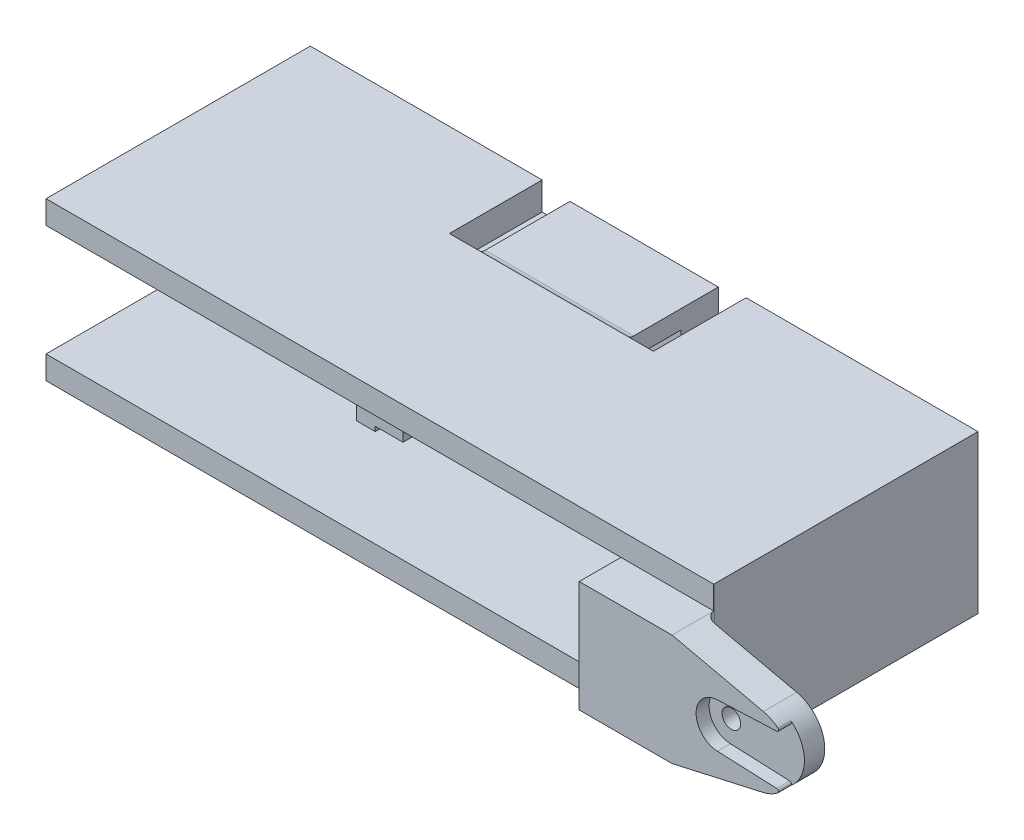
from build123d import *

# Parameters (mm, degrees)
BOSS_EXTRUDE1_DEPTH      = 8.5
BOSS_EXTRUDE1_DEPTH_BACK = 8.5
SKETCH1_W                = 72
SKETCH1_H                = 28.5
SKETCH2_W                = 31.201469113
SKETCH2_H                = 12
CUT_EXTRUDE1_DEPTH       = 69
SKETCH3_W                = 10
SKETCH3_H                = 17
BOSS_EXTRUDE2_DEPTH      = 3
CUT_EXTRUDE2_DEPTH       = 10
FILLET1_R                = 1
BOSS_EXTRUDE3_DEPTH      = 2
SKETCH8_W                = 12.8
SKETCH8_H                = 12.8
SKETCH8_R                = 3.26
SKETCH8_R_2              = 2.4
CUT_EXTRUDE3_DEPTH       = 2
SKETCH11_W               = 26
SKETCH11_H               = 12
BOSS_EXTRUDE7_DEPTH      = 3.1
SKETCH14_R               = 1
CUT_EXTRUDE4_DEPTH       = 62.43948242
CUT_EXTRUDE6_DEPTH       = 62.43948242
CUT_EXTRUDE7_DEPTH       = 62.43948242
BOSS_EXTRUDE8_DEPTH      = 14
SKETCH19_R               = 1
CUT_EXTRUDE8_DEPTH       = 5
SKETCH20_W               = 17.87603411
SKETCH20_H               = 5.867107887
CUT_EXTRUDE9_DEPTH       = 62.686708455
FILLET4_R                = 1
CUT_EXTRUDE10_DEPTH      = 10
BOSS_EXTRUDE9_START      = 1.4
BOSS_EXTRUDE9_DEPTH      = 1.4
FILLET5_R                = 0.2


with BuildPart() as part:
    # Sketch1 → Boss-Extrude1 (new, two sides: drawn at the far end of the back side and taken through both)
    with BuildSketch(Plane(origin=(0, 0, 0), x_dir=(1, 0, 0), z_dir=(0, 1, 0)).offset(-BOSS_EXTRUDE1_DEPTH_BACK)):
        with Locations((0, 14.25)):
            Rectangle(SKETCH1_W, SKETCH1_H)
    extrude(amount=BOSS_EXTRUDE1_DEPTH + BOSS_EXTRUDE1_DEPTH_BACK)

    # Sketch2 → Cut-Extrude1 (cut)
    with BuildSketch(Plane.ZY.offset(36)):
        with Locations((-10.899265443, 0)):
            Rectangle(SKETCH2_W, SKETCH2_H)
    extrude(amount=-CUT_EXTRUDE1_DEPTH, mode=Mode.SUBTRACT)

    # Sketch3 → Boss-Extrude2 (add)
    with BuildSketch(Plane.XY):
        with Locations((31, 0)):
            Rectangle(SKETCH3_W, SKETCH3_H)
    extrude(amount=-BOSS_EXTRUDE2_DEPTH)

    # Sketch6 → Cut-Extrude2 (cut)
    with BuildSketch(Plane(origin=(0, 0, -28.5), x_dir=(-1, 0, 0), z_dir=(0, 0, -1))):
        Polygon((-11, 8.5), (-11, 5.5), (-8, 5.5), (-8, 8), (8, 8), (8, 5.5), (11, 5.5), (11, 8.5), align=None)
        Polygon((-11, -5.5), (-11, -8.5), (11, -8.5), (11, -5.5), (8, -5.5), (8, -8), (-8, -8), (-8, -5.5), align=None)
    extrude(amount=-CUT_EXTRUDE2_DEPTH, mode=Mode.SUBTRACT)

    # Fillet1
    # the kernel refuses this fillet: 1 mm, written as the material it adds along each edge
    with BuildSketch(Plane(origin=(-8, -8, -18.5), x_dir=(0, 0, -1), z_dir=(1, 0, 0)), Plane(origin=(8, 8, -18.5), x_dir=(0, 0, -1), z_dir=(-1, 0, 0))) as fillet1_piece_1:
        with BuildLine():
            CenterArc((0.866025404, -1), FILLET1_R, 90, 60)
            Line((0, -0.5), (-0.017320508, -0.49))
            ThreePointArc((-0.017320508, -0.49), (-0.02, -0.25), (-0.02, 0))
            Line((-0.02, 0), (0, 0.02))
            Line((0, 0.02), (0.866025404, 0.02))
            Line((0.866025404, 0.02), (0.866025404, 0))
        make_face()
    extrude(amount=16)

    # Sketch7 → Boss-Extrude3 (add)
    with BuildSketch(Plane.XY.offset(-26.5)):
        Polygon((33, -6), (33, 6), (11, 6), (11, 5.5), (8, 5.5), (8, 6), (-8, 6), (-8, 5.5), (-11, 5.5), (-11, 6), (-13, 6), (-13, -6), (-11, -6), (-11, -5.5), (-8, -5.5), (-8, -6), (8, -6), (8, -5.5), (11, -5.5), (11, -6), align=None)
    extrude(amount=BOSS_EXTRUDE3_DEPTH)

    # Sketch8 → Cut-Extrude3 (cut)
    # profile 1 of 2: a face of its own
    with BuildSketch(Plane(origin=(0, 0, -28.5), x_dir=(-1, 0, 0), z_dir=(0, 0, -1))):
        Rectangle(SKETCH8_W, SKETCH8_H)
        Circle(SKETCH8_R, mode=Mode.SUBTRACT)
    # profile 2 of 2: a face of its own
    with BuildSketch(Plane(origin=(0, 0, -28.5), x_dir=(-1, 0, 0), z_dir=(0, 0, -1))):
        Circle(SKETCH8_R_2)
    extrude(amount=-CUT_EXTRUDE3_DEPTH, mode=Mode.SUBTRACT)

    # Sketch11 → Boss-Extrude7 (add)
    with BuildSketch(Plane.XY.offset(3.1)):
        with Locations((39, 0)):
            Rectangle(SKETCH11_W, SKETCH11_H)
    extrude(amount=-BOSS_EXTRUDE7_DEPTH)

    # Sketch14 → Cut-Extrude4 (cut, through all)
    with BuildSketch(Plane.XY.offset(3.1)):
        with Locations((41, 0)):
            Circle(SKETCH14_R)
    extrude(amount=-CUT_EXTRUDE4_DEPTH, mode=Mode.SUBTRACT)

    # Sketch15 → Cut-Extrude6 (cut, through all)
    with BuildSketch(Plane.XY.offset(3.1)):
        with BuildLine():
            Line((52, 6), (36, 6))
            Line((36, 6), (49.658536622, 2.92682926))
            ThreePointArc((49.658536622, 2.92682926), (51.34260644, 1.874085128), (52, 0))
            Line((52, 0), (52, 6))
        make_face()
    extrude(amount=-CUT_EXTRUDE6_DEPTH, mode=Mode.SUBTRACT)

    # Sketch17 → Cut-Extrude7 (cut, through all)
    with BuildSketch(Plane.XY.offset(3.1)):
        with BuildLine():
            Line((36, -6), (52, -6))
            Line((52, -6), (52, 0))
            ThreePointArc((52, 0), (51.342606414, -1.874085161), (49.658536541, -2.926829278))
            Line((49.658536541, -2.926829278), (36, -6))
        make_face()
    extrude(amount=-CUT_EXTRUDE7_DEPTH, mode=Mode.SUBTRACT)

    # Sketch18 → Boss-Extrude8 (add)
    with BuildSketch(Plane.XY.offset(-24.5)):
        Polygon((-11, 6), (-13, 6), (-13, -6), (-11, -6), (-11, -5.5), (-8, -5.5), (-8, 5.5), (-11, 5.5), align=None)
    extrude(amount=BOSS_EXTRUDE8_DEPTH)

    # Sketch19 → Cut-Extrude8 (cut)
    with BuildSketch(Plane.XY.offset(-10.5)):
        with Locations((-10.25, 0)):
            Circle(SKETCH19_R)
    extrude(amount=-CUT_EXTRUDE8_DEPTH, mode=Mode.SUBTRACT)

    # Sketch20 → Cut-Extrude9 (cut, through all)
    with BuildSketch(Plane.XZ.offset(8.5)):
        with Locations((44.938017055, -2.033553943)):
            Rectangle(SKETCH20_W, SKETCH20_H)
    extrude(amount=-CUT_EXTRUDE9_DEPTH, mode=Mode.SUBTRACT)

    # Fillet4
    # the kernel refuses this fillet: 1 mm, written as the material it adds along each edge
    with BuildSketch(Plane(origin=(36, -8.5, 0.9), x_dir=(1, 0, 0), z_dir=(0, 1, 0))) as fillet4_piece_1_section:
        with BuildLine():
            CenterArc((FILLET4_R, FILLET4_R), FILLET4_R, 180, 90)
            Line((0, FILLET4_R), (0, 0))
            Line((0, 0), (FILLET4_R, 0))
        make_face()
    fillet4_piece_1 = extrude(amount=14.5, mode=Mode.PRIVATE)
    fillet4_piece_1 = split(fillet4_piece_1, bisect_by=Plane(origin=(35.990889593, -7.251037957, 0), z_dir=(0, 0, -1)), keep=Keep.TOP, mode=Mode.PRIVATE)
    fillet4_piece_1 = split(fillet4_piece_1, bisect_by=Plane(origin=(35.723408497, -6.062233088, -0.048071683), z_dir=(0.21951219512195128, -0.9756097560975611, 0)), keep=Keep.TOP, mode=Mode.PRIVATE)
    fillet4_piece_1 = split(fillet4_piece_1, bisect_by=Plane(origin=(35.990889593, -6, -0.048071683), z_dir=(0, -1, 0)), keep=Keep.TOP, mode=Mode.PRIVATE)
    add(fillet4_piece_1)
    with BuildSketch(Plane(origin=(36, -6, 0.9), x_dir=(1, 0, 0), z_dir=(0, 1, 0))) as fillet4_piece_2_section:
        with BuildLine():
            CenterArc((FILLET4_R, FILLET4_R), FILLET4_R, 180, 90)
            Line((0, FILLET4_R), (0, 0))
            Line((0, 0), (FILLET4_R, 0))
        make_face()
    fillet4_piece_2 = extrude(amount=12, mode=Mode.PRIVATE)
    fillet4_piece_2 = split(fillet4_piece_2, bisect_by=Plane(origin=(36.226665296, 0, 0), z_dir=(0, 0, 1)), keep=Keep.TOP, mode=Mode.PRIVATE)
    fillet4_piece_2 = split(fillet4_piece_2, bisect_by=Plane(origin=(37.500692727, 5.662344136, 0.678804193), z_dir=(-0.2195121951219508, -0.9756097560975612, 0)), keep=Keep.TOP, mode=Mode.PRIVATE)
    fillet4_piece_2 = split(fillet4_piece_2, bisect_by=Plane(origin=(37.500692727, -5.662344136, 0.678804193), z_dir=(-0.21951219512195128, 0.9756097560975611, 0)), keep=Keep.TOP, mode=Mode.PRIVATE)
    add(fillet4_piece_2)
    with BuildSketch(Plane(origin=(36, -6, 0.9), x_dir=(1, 0, 0), z_dir=(0, 1, 0))) as fillet4_piece_3_section:
        with BuildLine():
            CenterArc((FILLET4_R, FILLET4_R), FILLET4_R, 180, 90)
            Line((0, FILLET4_R), (0, 0))
            Line((0, 0), (FILLET4_R, 0))
        make_face()
    fillet4_piece_3 = extrude(amount=12, mode=Mode.PRIVATE)
    fillet4_piece_3 = split(fillet4_piece_3, bisect_by=Plane(origin=(35.990886035, 0, 0), z_dir=(0, 0, -1)), keep=Keep.TOP, mode=Mode.PRIVATE)
    add(fillet4_piece_3)
    with BuildSketch(Plane(origin=(36, -6, 0.9), x_dir=(1, 0, 0), z_dir=(0, 1, 0))) as fillet4_piece_4_section:
        with BuildLine():
            CenterArc((FILLET4_R, FILLET4_R), FILLET4_R, 180, 90)
            Line((0, FILLET4_R), (0, 0))
            Line((0, 0), (FILLET4_R, 0))
        make_face()
    fillet4_piece_4 = extrude(amount=14.5, mode=Mode.PRIVATE)
    fillet4_piece_4 = split(fillet4_piece_4, bisect_by=Plane(origin=(35.990889593, 7.251037957, 0), z_dir=(0, 0, -1)), keep=Keep.TOP, mode=Mode.PRIVATE)
    fillet4_piece_4 = split(fillet4_piece_4, bisect_by=Plane(origin=(35.990889593, 6, -0.048071683), z_dir=(0, 1, 0)), keep=Keep.TOP, mode=Mode.PRIVATE)
    fillet4_piece_4 = split(fillet4_piece_4, bisect_by=Plane(origin=(35.723408497, 6.062233088, -0.048071683), z_dir=(0.2195121951219508, 0.9756097560975612, 0)), keep=Keep.TOP, mode=Mode.PRIVATE)
    add(fillet4_piece_4)

    # Sketch21 → Cut-Extrude10 (cut)
    with BuildSketch(Plane.XY.offset(3.1)):
        with BuildLine():
            ThreePointArc((48.87804878, 0), (48.028247344, -2.422597855), (45.851279032, -3.783462218))
            Line((45.851279032, -3.783462218), (49.658536585, -2.926829268))
            ThreePointArc((49.658536585, -2.926829268), (52, 0), (49.658536585, 2.926829268))
            Line((49.658536585, 2.926829268), (45.851279024, 3.78346222))
            ThreePointArc((45.851279024, 3.78346222), (48.028247342, 2.422597858), (48.87804878, 0))
        make_face()
    extrude(amount=-CUT_EXTRUDE10_DEPTH, mode=Mode.SUBTRACT)

    # Sketch23 → Boss-Extrude9 (add)
    with BuildSketch(Plane.XY.offset(3.1).offset(BOSS_EXTRUDE9_START)):
        with BuildLine():
            ThreePointArc((40.896590916, -2.397771165), (38.6, -8e-09), (40.896590899, 2.397771165))
            Line((40.896590899, 2.397771165), (47.78858717, 2.695003514))
            ThreePointArc((47.78858717, 2.695003514), (46.899563641, 3.380964406), (45.851279001, 3.783462225))
            Line((45.851279001, 3.783462225), (36, 6))
            Line((36, 6), (26, 6))
            Line((26, 6), (26, -6))
            Line((26, -6), (36, -6))
            Line((36, -6), (45.851279001, -3.783462225))
            ThreePointArc((45.851279001, -3.783462225), (46.899563641, -3.380964406), (47.78858717, -2.695003514))
            Line((47.78858717, -2.695003514), (40.896590916, -2.397771165))
        make_face()
    extrude(amount=-BOSS_EXTRUDE9_DEPTH)

    # Fillet5
    fillet5_edges = [part.edges().sort_by_distance(p)[0] for p in [
        (47.78858717, 2.695003514, 3.8),
        (47.78858717, -2.695003514, 3.8),
    ]]
    fillet(fillet5_edges, radius=FILLET5_R)


solid = part.part
